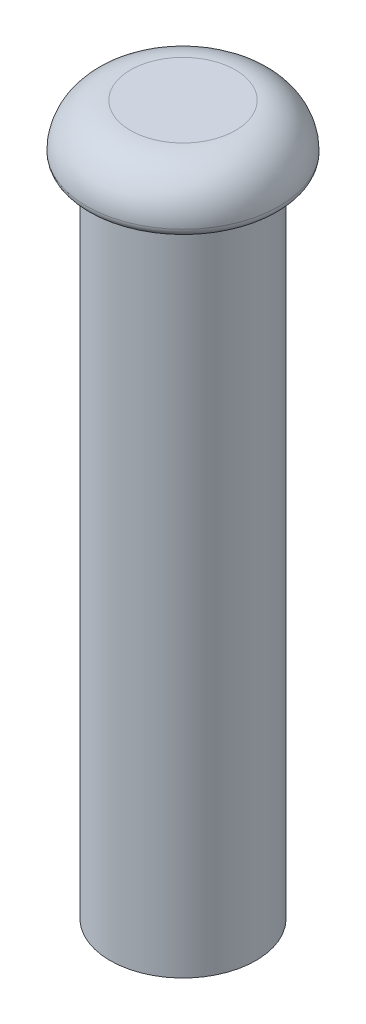
from build123d import *

# Parameters (mm, degrees)
SZKIC1_R                    = 25
DODANIE_WYCI_GNI_CIE1_DEPTH = 225
SZKIC2_R                    = 33
DODANIE_WYCI_GNI_CIE2_DEPTH = 18
ZAOKR_GLENIE1_R             = 15
ZAOKR_GLENIE2_R             = 3


with BuildPart() as part:
    # Szkic1 → Dodanie-wyciągnięcie1 (new body)
    with BuildSketch(Plane(origin=(0, 0, 0), x_dir=(1, 0, 0), z_dir=(0, 1, 0))):
        with Locations(Location((0, 0, 0), (0, 0, 270))):
            Circle(SZKIC1_R)
    extrude(amount=DODANIE_WYCI_GNI_CIE1_DEPTH)

    # Szkic2 → Dodanie-wyciągnięcie2 (add)
    with BuildSketch(Plane(origin=(0, 225, 0), x_dir=(1, 0, 0), z_dir=(0, 1, 0))):
        with Locations(Location((0, 0, 0), (0, 0, 270))):
            Circle(SZKIC2_R)
    extrude(amount=DODANIE_WYCI_GNI_CIE2_DEPTH)

    # Zaokrąglenie1
    zaokr_glenie1_edges = [part.edges().sort_by_distance(p)[0] for p in [
        (0, 243, -33),
    ]]
    fillet(zaokr_glenie1_edges, radius=ZAOKR_GLENIE1_R)

    # Zaokrąglenie2
    zaokr_glenie2_edges = [part.edges().sort_by_distance(p)[0] for p in [
        (0, 225, -33),
    ]]
    fillet(zaokr_glenie2_edges, radius=ZAOKR_GLENIE2_R - 0.0001)  # a hair under: the kernel refuses the full size


solid = part.part
